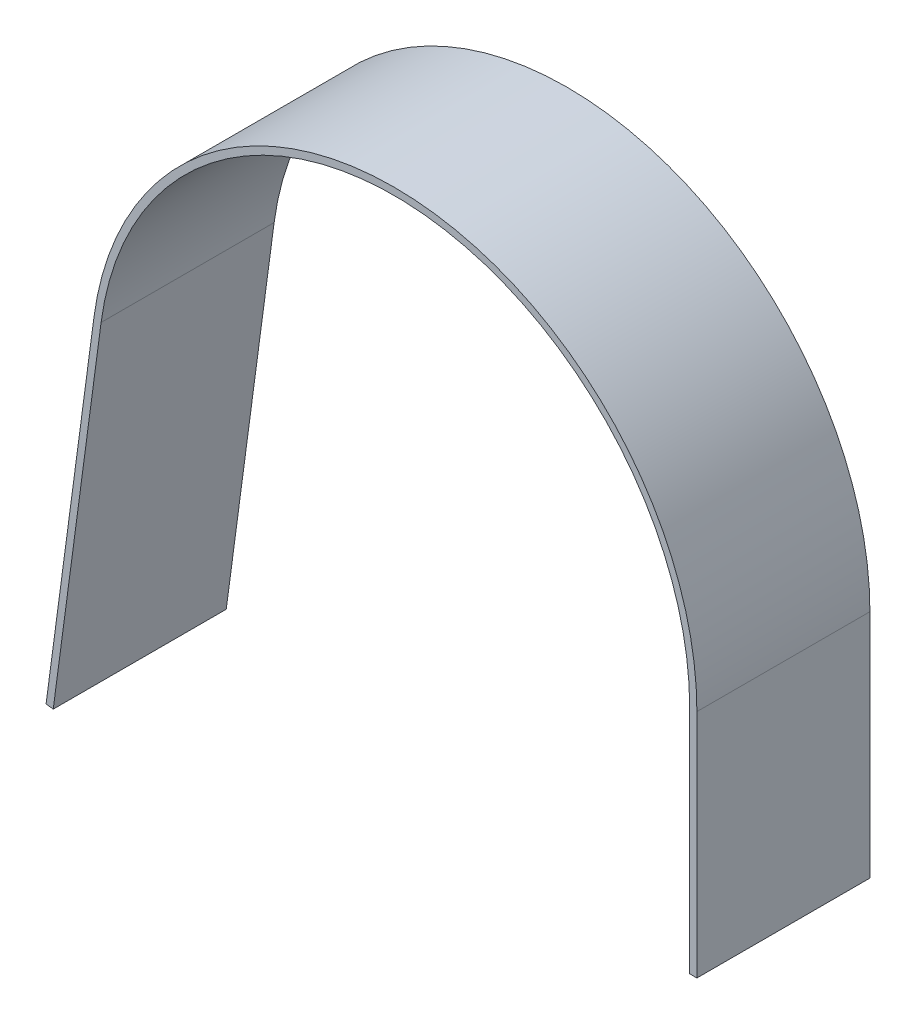
from build123d import *

# Parameters (mm, degrees)
BOSS_EXTRUDE1_DEPTH = 76.2


with BuildPart() as part:
    # Sketch2 → Boss-Extrude1 (new body)
    with BuildSketch(Plane.XY):
        with BuildLine():
            Line((-7.537728732, -7.476944591), (-7.537728732, 94.123055409))
            ThreePointArc((-7.537728732, 94.123055409), (-132.050716948, 227.179921908), (-273.066483478, 111.75822747))
            Line((-273.066483478, 111.75822747), (-294.150155098, -46.267645507))
            Line((-294.150155098, -46.267645507), (-291.003041889, -46.687530556))
            Line((-291.003041889, -46.687530556), (-269.91937027, 111.338342421))
            ThreePointArc((-269.91937027, 111.338342421), (-132.26112199, 224.011901277), (-10.712728732, 94.123055409))
            Line((-10.712728732, 94.123055409), (-10.712728732, -7.476944591))
            Line((-10.712728732, -7.476944591), (-7.537728732, -7.476944591))
        make_face()
    extrude(amount=BOSS_EXTRUDE1_DEPTH)


solid = part.part
